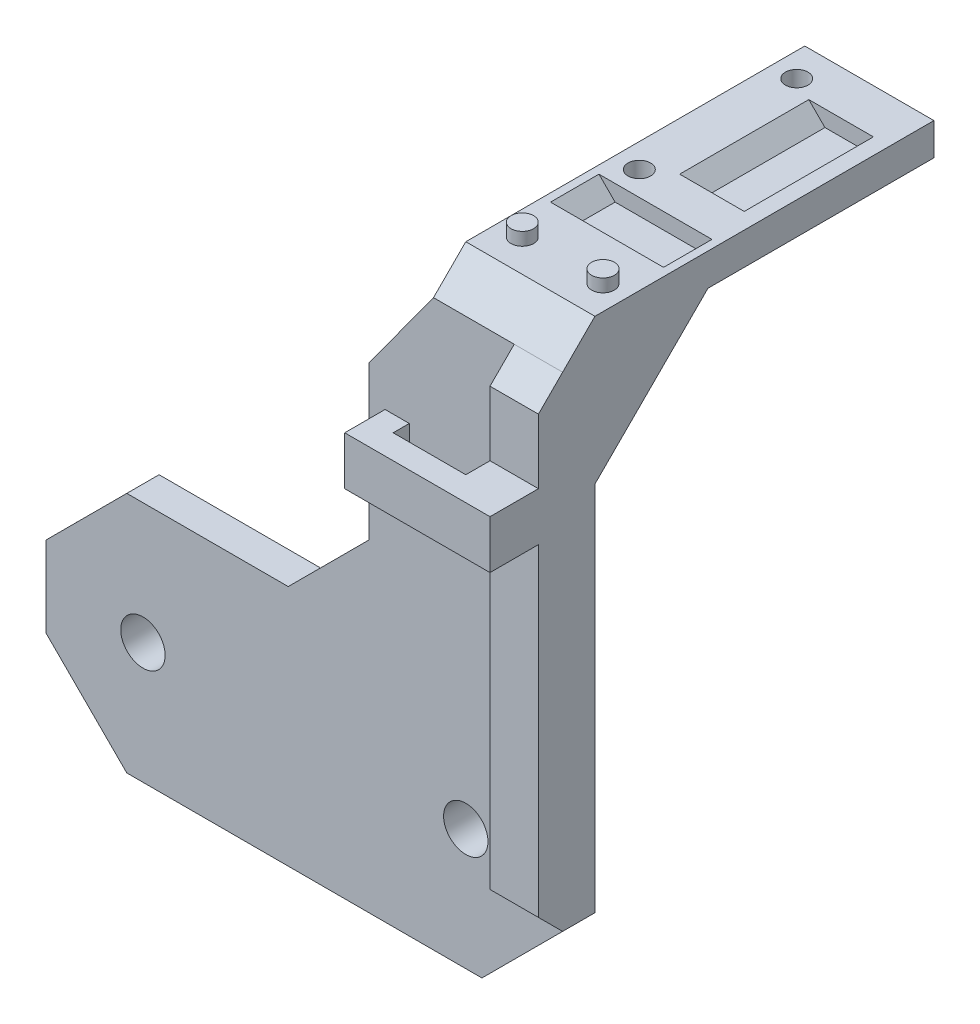
from build123d import *

# Parameters (mm, degrees)
SKETCH1_W           = 24
SKETCH1_H           = 74
BOSS_EXTRUDE1_DEPTH = 4
SKETCH3_W           = 24
SKETCH3_H           = 4
BOSS_EXTRUDE2_DEPTH = 42
CHAMFER1_SIZE       = 14
CHAMFER2_SIZE       = 4
SKETCH4_W           = 8
SKETCH4_H           = 42
CUT_EXTRUDE3_DEPTH  = 30
SKETCH5_R           = 1.4
BOSS_EXTRUDE3_DEPTH = 1.6
CUT_EXTRUDE4_REACH  = 87.93
SKETCH6_R           = 1.4
BOSS_EXTRUDE4_DEPTH = 6
CUT_EXTRUDE6_REACH  = 60.292
SKETCH11_W          = 40
SKETCH11_H          = 30
BOSS_EXTRUDE6_DEPTH = 4
CUT_EXTRUDE2_REACH  = 79.188
SKETCH2_R           = 2.75
CHAMFER3_SIZE       = 10
SKETCH12_W          = 3
SKETCH12_H          = 60
BOSS_EXTRUDE7_DEPTH = 6
CHAMFER4_SIZE       = 3
SKETCH13_W          = 4
SKETCH13_H          = 16
SKETCH13_W_2        = 10
SKETCH13_H_2        = 6
CUT_EXTRUDE7_DEPTH  = 2
CHAMFER5_SIZE       = 2


with BuildPart() as part:
    # Sketch1 → Boss-Extrude1 (new body)
    with BuildSketch(Plane.XY):
        Rectangle(SKETCH1_W, SKETCH1_H)
    extrude(amount=BOSS_EXTRUDE1_DEPTH)

    # Sketch3 → Boss-Extrude2 (add)
    with BuildSketch(Plane.XY):
        with Locations((0, 35)):
            Rectangle(SKETCH3_W, SKETCH3_H)
    extrude(amount=-BOSS_EXTRUDE2_DEPTH)

    # Chamfer1
    chamfer1_edges = [part.edges().sort_by_distance(p)[0] for p in [
        (0, 33, 0),
    ]]
    chamfer(chamfer1_edges, length=CHAMFER1_SIZE)

    # Chamfer2
    chamfer2_edges = [part.edges().sort_by_distance(p)[0] for p in [
        (0, 37, 4),
    ]]
    chamfer(chamfer2_edges, length=CHAMFER2_SIZE)

    # Sketch4 → Cut-Extrude3 (cut)
    with BuildSketch(Plane(origin=(0, 37, 0), x_dir=(1, 0, 0), z_dir=(0, 1, 0))):
        with Locations((-8, 21)):
            Rectangle(SKETCH4_W, SKETCH4_H)
    extrude(amount=-CUT_EXTRUDE3_DEPTH, mode=Mode.SUBTRACT)

    # Sketch5 → Boss-Extrude3 (add)
    with BuildSketch(Plane(origin=(0, 37, 0), x_dir=(1, 0, 0), z_dir=(0, 1, 0))):
        with Locations(Location((-1, 4, 0), (0, 0, 90))):
            Circle(SKETCH5_R)
        with Locations(Location((9, 4, 0), (0, 0, 90))):
            Circle(SKETCH5_R)
    extrude(amount=BOSS_EXTRUDE3_DEPTH)

    # Sketch6 → Cut-Extrude4 (cut, up to next)
    with BuildSketch(Plane(origin=(0, 37, 0), x_dir=(1, 0, 0), z_dir=(0, 1, 0)), mode=Mode.PRIVATE) as cut_extrude4_sk1:
        with Locations(Location((-1, 18.5, 0), (0, 0, 270))):
            Circle(SKETCH6_R)
    cut_extrude4_tool1 = extrude(cut_extrude4_sk1.sketch, amount=-CUT_EXTRUDE4_REACH, mode=Mode.PRIVATE) & part.part
    # Sketch6 → Cut-Extrude4 (cut, up to next)
    with BuildSketch(Plane(origin=(0, 37, 0), x_dir=(1, 0, 0), z_dir=(0, 1, 0)), mode=Mode.PRIVATE) as cut_extrude4_sk2:
        with Locations(Location((-1, 38, 0), (0, 0, 270))):
            Circle(SKETCH6_R)
    cut_extrude4_tool2 = extrude(cut_extrude4_sk2.sketch, amount=-CUT_EXTRUDE4_REACH, mode=Mode.PRIVATE) & part.part
    add(cut_extrude4_tool1.solids().sort_by_distance((-1, 37, -18.5))[0], mode=Mode.SUBTRACT)
    add(cut_extrude4_tool2.solids().sort_by_distance((-1, 37, -38))[0], mode=Mode.SUBTRACT)

    # Sketch7 → Boss-Extrude4 (add)
    with BuildSketch(Plane(origin=(0, 22, 0), x_dir=(1, 0, 0), z_dir=(0, 1, 0))):
        Polygon((12, -4), (12, -13), (-6, -13), (-6, -8), (-3, -8), (-3, -10), (6, -10), (6, -4), align=None)
    extrude(amount=-BOSS_EXTRUDE4_DEPTH)

    # Sketch9 → Cut-Extrude6 (cut, up to next)
    with BuildSketch(Plane.XY, mode=Mode.PRIVATE) as cut_extrude6_sk1:
        Polygon((-4, 37), (-4, 33), (-12, 22), (-12, 37), align=None)
    cut_extrude6_tool1 = extrude(cut_extrude6_sk1.sketch, amount=CUT_EXTRUDE6_REACH, mode=Mode.PRIVATE) & part.part
    add(cut_extrude6_tool1.solids().sort_by_distance((-8.77193, 31.719298, 0))[0], mode=Mode.SUBTRACT)

    # Sketch11 → Boss-Extrude6 (add)
    with BuildSketch(Plane.XY):
        with Locations((-32, -22)):
            Rectangle(SKETCH11_W, SKETCH11_H)
    extrude(amount=BOSS_EXTRUDE6_DEPTH)

    # Sketch2 → Cut-Extrude2 (cut, up to next)
    with BuildSketch(Plane.XY, mode=Mode.PRIVATE) as cut_extrude2_sk1:
        with Locations((0, -22)):
            Circle(SKETCH2_R)
    cut_extrude2_tool1 = extrude(cut_extrude2_sk1.sketch, amount=CUT_EXTRUDE2_REACH, mode=Mode.PRIVATE) & part.part
    # Sketch2 → Cut-Extrude2 (cut, up to next)
    with BuildSketch(Plane.XY, mode=Mode.PRIVATE) as cut_extrude2_sk2:
        with Locations((-40, -22)):
            Circle(SKETCH2_R)
    cut_extrude2_tool2 = extrude(cut_extrude2_sk2.sketch, amount=CUT_EXTRUDE2_REACH, mode=Mode.PRIVATE) & part.part
    add(cut_extrude2_tool1.solids().sort_by_distance((0, -22, 0))[0], mode=Mode.SUBTRACT)
    add(cut_extrude2_tool2.solids().sort_by_distance((-40, -22, 0))[0], mode=Mode.SUBTRACT)

    # Chamfer3
    chamfer3_edges = [part.edges().sort_by_distance(p)[0] for p in [
        (-12, -7, 2),
        (-52, -37, 2),
        (-52, -7, 2),
        (12, -37, 2),
    ]]
    chamfer(chamfer3_edges, length=CHAMFER3_SIZE)

    # Sketch12 → Boss-Extrude7 (add)
    with BuildSketch(Plane(origin=(12, 0, 0), x_dir=(0, 0, -1), z_dir=(1, 0, 0))):
        with Locations((-5.5, 3)):
            Rectangle(SKETCH12_W, SKETCH12_H)
    extrude(amount=-BOSS_EXTRUDE7_DEPTH)

    # Chamfer4
    chamfer4_edges = [part.edges().sort_by_distance(p)[0] for p in [
        (9, 33, 7),
        (9, -27, 7),
    ]]
    chamfer(chamfer4_edges, length=CHAMFER4_SIZE - 0.0001)  # a hair under: the kernel refuses the full size

    # Sketch13 → Cut-Extrude7 (cut)
    with BuildSketch(Plane(origin=(0, 37, 0), x_dir=(1, 0, 0), z_dir=(0, 1, 0))):
        with Locations((6, 28.5)):
            Rectangle(SKETCH13_W, SKETCH13_H)
        with Locations((4, 12.5)):
            Rectangle(SKETCH13_W_2, SKETCH13_H_2)
    extrude(amount=-CUT_EXTRUDE7_DEPTH, mode=Mode.SUBTRACT)

    # Chamfer5
    chamfer5_edges = [part.edges().sort_by_distance(p)[0] for p in [
        (4, 37, -28.5),
        (-1, 37, -12.5),
        (9, 37, -12.5),
        (8, 37, -28.5),
    ]]
    chamfer(chamfer5_edges, length=CHAMFER5_SIZE - 0.0001)  # a hair under: the kernel refuses the full size


solid = part.part
